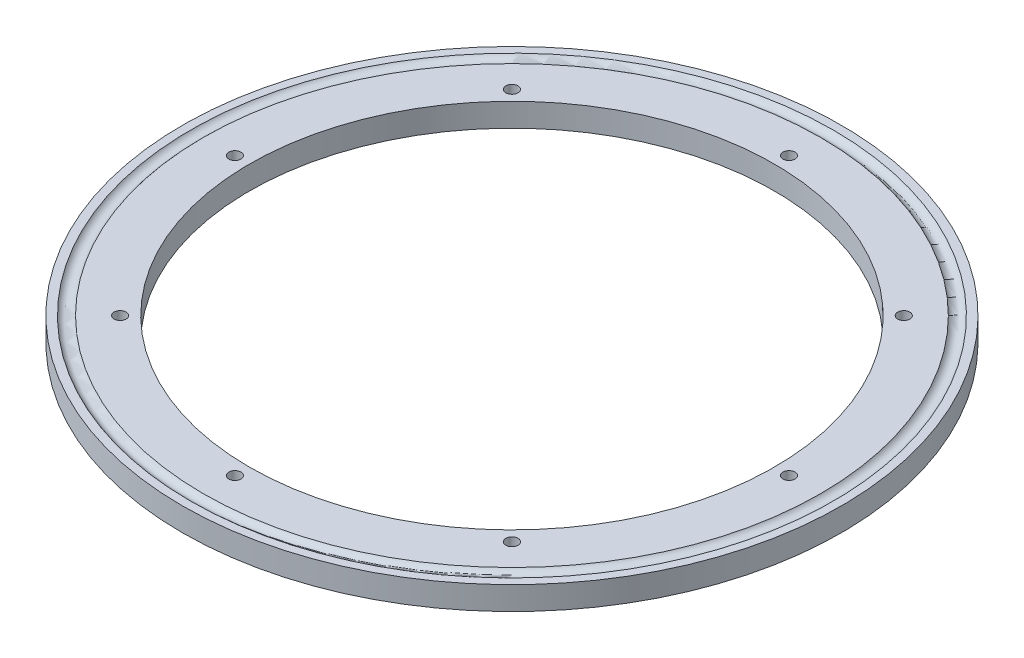
from build123d import *

# Parameters (mm, degrees)
SKETCH1_R           = 71.755
SKETCH1_R_2         = 1.3208
SKETCH1_R_3         = 57.15
BOSS_EXTRUDE1_DEPTH = 5.08


with BuildPart() as part:
    # Sketch1 → Boss-Extrude1 (new body)
    with BuildSketch(Plane(origin=(0, 0, 0), x_dir=(1, 0, 0), z_dir=(0, 1, 0))):
        Circle(SKETCH1_R)
        with Locations((42.656216575, 42.656216575)):
            Circle(SKETCH1_R_2, mode=Mode.SUBTRACT)
        with Locations((-42.656216575, -42.656216575)):
            Circle(SKETCH1_R_2, mode=Mode.SUBTRACT)
        with Locations((0, -60.325)):
            Circle(SKETCH1_R_2, mode=Mode.SUBTRACT)
        with Locations((42.656216575, -42.656216575)):
            Circle(SKETCH1_R_2, mode=Mode.SUBTRACT)
        with Locations((-60.325, 0)):
            Circle(SKETCH1_R_2, mode=Mode.SUBTRACT)
        with Locations((-42.656216575, 42.656216575)):
            Circle(SKETCH1_R_2, mode=Mode.SUBTRACT)
        Circle(SKETCH1_R_3, mode=Mode.SUBTRACT)
        with Locations((60.325, 0)):
            Circle(SKETCH1_R_2, mode=Mode.SUBTRACT)
        with Locations((0, 60.325)):
            Circle(SKETCH1_R_2, mode=Mode.SUBTRACT)
    extrude(amount=BOSS_EXTRUDE1_DEPTH)

    # Sketch2 → Cut-Revolve1 (revolve, cut)
    with BuildSketch(Plane(origin=(0, 0, 0), x_dir=(0, 0, -1), z_dir=(1, 0, 0))):
        with BuildLine():
            ThreePointArc((69.971215296, 0), (68.58, 0.762), (67.188784704, 0))
            Line((67.188784704, 0), (69.971215296, 0))
        make_face()
        with BuildLine():
            ThreePointArc((67.188784704, 5.08), (68.58, 4.318), (69.971215296, 5.08))
            Line((69.971215296, 5.08), (67.188784704, 5.08))
        make_face()
    revolve(axis=Axis((0, 0, 0), (0, 1, 0)), mode=Mode.SUBTRACT)


solid = part.part
